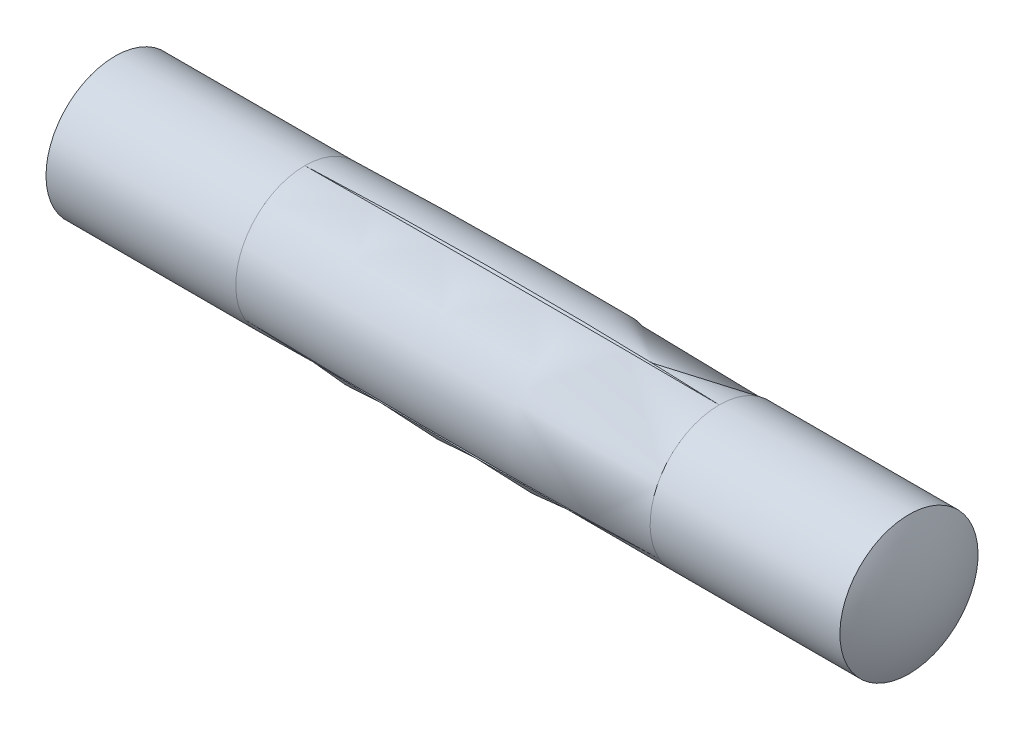
from build123d import *

# Parameters (mm, degrees)
CUT_EXTRUDE1_DEPTH = 7.5
CIRPATTERN2_COUNT  = 3


with BuildPart() as part:
    # Sketch1 → Revolve3 (revolve)
    with BuildSketch(Plane.XY):
        with BuildLine():
            Line((-14.37, 2.5), (14.37, 2.5))
            ThreePointArc((14.37, 2.5), (14.840075907, 1.289079129), (15, 0))
            Line((15, 0), (-15, 0))
            ThreePointArc((-15, 0), (-14.840075907, 1.289079129), (-14.37, 2.5))
        make_face()
    revolve(axis=Axis((-15, 0, 0), (1, 0, 0)))

    # Sketch2 → Revolve4 (revolve)
    with BuildSketch(Plane.XY):
        with BuildLine():
            Line((-7.5, 2.5), (-7.5, 0))
            Line((-7.5, 0), (7.5, 0))
            Line((7.5, 0), (7.5, 2.5))
            ThreePointArc((7.5, 2.5), (0, 2.6), (-7.5, 2.5))
        make_face()
    revolve(axis=Axis((0, 0, 0), (1, 0, 0)))

    # Sketch3 → Cut-Extrude1 (cut, symmetric)
    with BuildSketch(Plane(origin=(0, 0, 0), x_dir=(0, 0, -1), z_dir=(1, 0, 0))):
        with BuildLine():
            Line((0, 2.5), (-0.114715287, 2.663830409))
            ThreePointArc((-0.114715287, 2.663830409), (0, 2.7), (0.114715287, 2.663830409))
            Line((0.114715287, 2.663830409), (0, 2.5))
        make_face()
    cut_extrude1 = extrude(amount=CUT_EXTRUDE1_DEPTH, both=True, mode=Mode.SUBTRACT)

    # CirPattern2: Cut-Extrude1 ×3 about axis
    cirpattern2_axis = Axis((-15, 0, 0), (1, 0, 0))
    for i in range(1, CIRPATTERN2_COUNT):
        add(cut_extrude1.rotate(cirpattern2_axis, i * 360 / CIRPATTERN2_COUNT), mode=Mode.SUBTRACT)


solid = part.part
